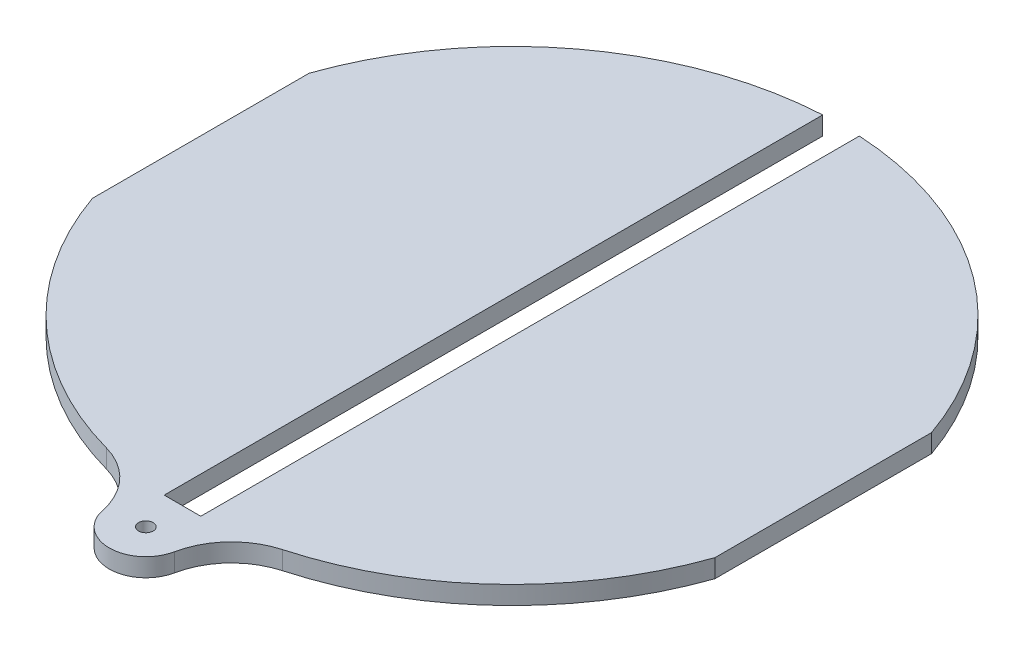
from build123d import *

# Parameters (mm, degrees)
BOSS_EXTRUDE1_DEPTH     = 3.175
SKETCH3_R               = 1.27
CUT_EXTRUDE1_DEPTH      = 86.84251205
CUT_EXTRUDE2_DEPTH      = 86.84251205
CUT_EXTRUDE2_DEPTH_BACK = 86.84251205
FILLET1_R               = 12.7


with BuildPart() as part:
    # Sketch2 → Boss-Extrude1 (new body)
    with BuildSketch(Plane(origin=(0, 0, 0), x_dir=(1, 0, 0), z_dir=(0, 1, 0))):
        with BuildLine():
            Line((3.175, 60.325), (53.975, 60.325))
            Line((53.975, 60.325), (53.975, -60.325))
            Line((53.975, -60.325), (6.35, -60.325))
            ThreePointArc((6.35, -60.325), (0, -66.675), (-6.35, -60.325))
            Line((-6.35, -60.325), (-53.975, -60.325))
            Line((-53.975, -60.325), (-53.975, 60.325))
            Line((-53.975, 60.325), (-3.175, 60.325))
            Line((-3.175, 60.325), (-3.175, -53.975))
            Line((-3.175, -53.975), (3.175, -53.975))
            Line((3.175, -53.975), (3.175, 60.325))
        make_face()
    extrude(amount=BOSS_EXTRUDE1_DEPTH)

    # Sketch3 → Cut-Extrude1 (cut, through all)
    with BuildSketch(Plane(origin=(0, 3.175, 0), x_dir=(1, 0, 0), z_dir=(0, 1, 0))):
        with Locations((0, -60.325)):
            Circle(SKETCH3_R)
    extrude(amount=-CUT_EXTRUDE1_DEPTH, mode=Mode.SUBTRACT)

    # Sketch4 → Cut-Extrude2 (cut, two sides: drawn at the far end of the back side and taken through both)
    with BuildSketch(Plane(origin=(0, 3.175, 0), x_dir=(1, 0, 0), z_dir=(0, 1, 0)).offset(-CUT_EXTRUDE2_DEPTH_BACK)):
        with BuildLine():
            Line((-53.975, -60.325), (-6.35, -60.325))
            Line((-6.35, -60.325), (-6.35, -53.621126628))
            ThreePointArc((-6.35, -53.621126628), (-35.651302063, -41.491622451), (-53.975, -15.608553311))
            Line((-53.975, -15.608553311), (-53.975, -60.325))
        make_face()
        with BuildLine():
            Line((53.975, -60.325), (53.975, -15.608553311))
            ThreePointArc((53.975, -15.608553311), (35.651302063, -41.491622451), (6.35, -53.621126628))
            Line((6.35, -53.621126628), (6.35, -60.325))
            Line((6.35, -60.325), (53.975, -60.325))
        make_face()
        with BuildLine():
            Line((-53.975, 60.325), (-53.975, 21.958553311))
            ThreePointArc((-53.975, 21.958553311), (-34.392375162, 48.818039236), (-3.175, 60.236737399))
            Line((-3.175, 60.236737399), (-3.175, 60.325))
            Line((-3.175, 60.325), (-53.975, 60.325))
        make_face()
        with BuildLine():
            Line((53.975, 60.325), (3.175, 60.325))
            Line((3.175, 60.325), (3.175, 60.236737399))
            ThreePointArc((3.175, 60.236737399), (34.392375162, 48.818039236), (53.975, 21.958553311))
            Line((53.975, 21.958553311), (53.975, 60.325))
        make_face()
    extrude(amount=CUT_EXTRUDE2_DEPTH + CUT_EXTRUDE2_DEPTH_BACK, mode=Mode.SUBTRACT)

    # Fillet1
    fillet1_edges = [part.edges().sort_by_distance(p)[0] for p in [
        (6.35, 1.5875, 53.621126628),
        (-6.35, 1.5875, 53.621126628),
    ]]
    fillet(fillet1_edges, radius=FILLET1_R)


solid = part.part
